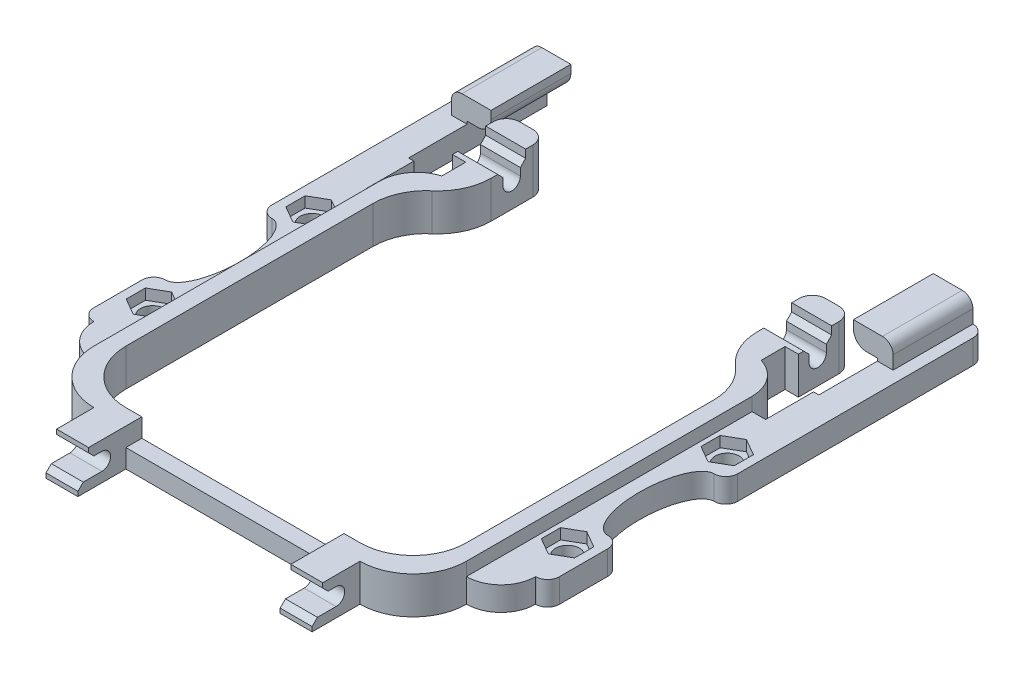
from build123d import *

# Parameters (mm, degrees)
BOSS_EXTRUDE1_DEPTH            = 7
CUT_EXTRUDE2_REACH             = 79.782
SKETCH2_W                      = 2
SKETCH2_H                      = 1.875
CUT_EXTRUDE5_DEPTH             = 65
CUT_EXTRUDE8_START             = -7
SKETCH9_W                      = 5
SKETCH9_H                      = 4.5
CUT_EXTRUDE8_DEPTH             = 7
FILLET1_R                      = 7
FILLET3_R                      = 10
FILLET5_R                      = 10
FILLET6_R                      = 10
FILLET7_R                      = 10
FILLET8_R                      = 2.5
CHAMFER2_SIZE                  = 1
CUT_EXTRUDE7_REACH             = 94.19
SKETCH20_W                     = 38
SKETCH20_H                     = 3.5
SKETCH22_W                     = 53.666796068
SKETCH22_H                     = 4.5
BOSS_EXTRUDE9_DEPTH            = 6.5
SKETCH24_W                     = 3.95
SKETCH24_H                     = 4.5
BOSS_EXTRUDE11_DEPTH           = 35
SKETCH25_W                     = 3.95
SKETCH25_H                     = 15
BOSS_EXTRUDE12_DEPTH           = 4.5
SKETCH28_W                     = 15
SKETCH28_H                     = 4
BOSS_EXTRUDE13_DEPTH           = 3.5
FILLET16_R                     = 2
FILLET17_R                     = 2.5
M4_CLEARANCE_HOLE1_D           = 4.5
M4_CLEARANCE_HOLE1_CSINK_D     = 4.55
M4_CLEARANCE_HOLE1_CSINK_ANGLE = 90
CUT_EXTRUDE9_REACH             = 77.297
SKETCH33_RX                    = 10
SKETCH33_RY                    = 4
SKETCH35_W                     = 1
SKETCH35_H                     = 5
CUT_EXTRUDE11_DEPTH            = 26
FILLET16_OF_MIRROR9_R          = 2
FILLET17_OF_MIRROR9_R          = 2.5
FILLET23_R                     = 6.5
SKETCH36_W                     = 48.666796068
SKETCH36_H                     = 4.5
SKETCH36_W_2                   = 13.5
BOSS_EXTRUDE14_DEPTH           = 2.25
FILLET24_R                     = 2.2
CUT_EXTRUDE12_DEPTH            = 2
FILLET24_OF_MIRROR10_R         = 2.2
BOSS_EXTRUDE15_START           = 1.5
BOSS_EXTRUDE15_DEPTH           = 1.5
CHAMFER4_SIZE                  = 1


# Some blends are built 0.0001 mm under size
with BuildPart() as part:
    # Sketch1 → Boss-Extrude1 (new body)
    with BuildSketch(Plane(origin=(0, 0, 0), x_dir=(1, 0, 0), z_dir=(0, 1, 0))):
        Polygon((-19, -45), (-19, -36), (19, -36), (19, -45), (25, -45), (25, -36), (35, -36), (35, 36), (32.5, 36), (32.5, 49), (25, 49), (25, 36), (25, 33), (32, 33), (32, -33), (-32, -33), (-32, 33), (-25, 33), (-25, 36), (-25, 49), (-32.5, 49), (-32.5, 36), (-35, 36), (-35, -36), (-25, -36), (-25, -45), align=None)
    extrude(amount=BOSS_EXTRUDE1_DEPTH)

    # Sketch2 → Cut-Extrude2 (cut, up to next)
    with BuildSketch(Plane(origin=(25, 0, 0), x_dir=(0, 0, -1), z_dir=(1, 0, 0)), mode=Mode.PRIVATE) as cut_extrude2_sk1:
        with Locations((-44, 6.0625)):
            Rectangle(SKETCH2_W, SKETCH2_H)
    cut_extrude2_tool1 = extrude(cut_extrude2_sk1.sketch, amount=-CUT_EXTRUDE2_REACH, mode=Mode.PRIVATE) & part.part
    # Sketch2 → Cut-Extrude2 (cut, up to next)
    with BuildSketch(Plane(origin=(25, 0, 0), x_dir=(0, 0, -1), z_dir=(1, 0, 0)), mode=Mode.PRIVATE) as cut_extrude2_sk2:
        with BuildLine():
            Line((-43, 5.125), (-45, 5.125))
            Line((-45, 5.125), (-45, 1.875))
            Line((-45, 1.875), (-40.5, 1.875))
            ThreePointArc((-40.5, 1.875), (-38.875, 3.5), (-40.5, 5.125))
            Line((-40.5, 5.125), (-43, 5.125))
        make_face()
    cut_extrude2_tool2 = extrude(cut_extrude2_sk2.sketch, amount=-CUT_EXTRUDE2_REACH, mode=Mode.PRIVATE) & part.part
    add(cut_extrude2_tool1.solids().sort_by_distance((25, 6.0625, 44))[0], mode=Mode.SUBTRACT)
    add(cut_extrude2_tool1.solids().sort_by_distance((25, 6.0625, 44))[1], mode=Mode.SUBTRACT)
    add(cut_extrude2_tool2.solids().sort_by_distance((25, 3.5, 42.100477))[0], mode=Mode.SUBTRACT)
    add(cut_extrude2_tool2.solids().sort_by_distance((25, 3.5, 42.100477))[1], mode=Mode.SUBTRACT)

    # Sketch3 → Cut-Extrude5 (cut)
    with BuildSketch(Plane(origin=(32.5, 0, 0), x_dir=(0, 0, -1), z_dir=(1, 0, 0))):
        with BuildLine():
            Line((44.125, 4.625), (44.125, 7))
            Line((44.125, 7), (40.875, 7))
            Line((40.875, 7), (40.875, 4.625))
            ThreePointArc((40.875, 4.625), (42.5, 3), (44.125, 4.625))
        make_face()
    extrude(amount=-CUT_EXTRUDE5_DEPTH, mode=Mode.SUBTRACT)

    # Sketch9 → Cut-Extrude8 (cut)
    with BuildSketch(Plane(origin=(0, 7, 0), x_dir=(1, 0, 0), z_dir=(0, 1, 0)).offset(CUT_EXTRUDE8_START)):
        with Locations((32.5, 36.625)):
            Rectangle(SKETCH9_W, SKETCH9_H)
    cut_extrude8 = extrude(amount=CUT_EXTRUDE8_DEPTH, mode=Mode.SUBTRACT)

    # Mirror1: Cut-Extrude8 across plane
    add(cut_extrude8.mirror(Plane.ZY), mode=Mode.SUBTRACT)

    # Fillet1
    # the kernel refuses this fillet: 7 mm, written as the material it takes off along each edge
    with BuildSketch(Plane(origin=(35, -16.770509831, -34.375), x_dir=(-1, 0, 0), z_dir=(0, 1, 0))) as fillet1_piece_1:
        with BuildLine():
            CenterArc((7, 6.708203932), FILLET1_R, 180, 73.398450401)
            Line((0, 6.708203932), (-0.14, 6.708203932))
            Line((-0.14, 6.708203932), (-0.14, 0))
            Line((-0.14, 0), (0, -0.14))
            ThreePointArc((0, -0.14), (2.5, -0.14), (4.96, -0.134164079))
            Line((4.96, -0.134164079), (5, 0))
        make_face()
    extrude(amount=40.541019662, mode=Mode.SUBTRACT)
    with BuildSketch(Plane(origin=(-35, -16.770509831, -34.375), x_dir=(0, 0, 1), z_dir=(0, 1, 0))) as fillet1_piece_2:
        with BuildLine():
            CenterArc((6.708203932, 7), FILLET1_R, 196.601549599, 73.398450401)
            Line((0, 5), (-0.134164079, 4.96))
            ThreePointArc((-0.134164079, 4.96), (-0.14, 2.5), (-0.14, 0))
            Line((-0.14, 0), (0, -0.14))
            Line((0, -0.14), (6.708203932, -0.14))
            Line((6.708203932, -0.14), (6.708203932, 0))
        make_face()
    extrude(amount=40.541019662, mode=Mode.SUBTRACT)

    # Fillet3
    # the kernel refuses this fillet: 10 mm, written as the material it adds along each edge
    with BuildSketch(Plane(origin=(32, 0, -33), x_dir=(0, 0, 1), z_dir=(0, 1, 0))) as fillet3_piece_1:
        with BuildLine():
            CenterArc((9.539392014, -10), FILLET3_R, 90, 72.542396876)
            Line((0, -7), (-0.19078784, -6.94))
            ThreePointArc((-0.19078784, -6.94), (-0.2, -3.5), (-0.2, 0))
            Line((-0.2, 0), (0, 0.2))
            Line((0, 0.2), (9.539392014, 0.2))
            Line((9.539392014, 0.2), (9.539392014, 0))
        make_face()
    extrude(amount=7)
    with BuildSketch(Plane(origin=(-32, 0, -33), x_dir=(1, 0, 0), z_dir=(0, 1, 0))) as fillet3_piece_2:
        with BuildLine():
            CenterArc((10, -9.539392014), FILLET3_R, 107.457603124, 72.542396876)
            Line((0, -9.539392014), (-0.2, -9.539392014))
            Line((-0.2, -9.539392014), (-0.2, 0))
            Line((-0.2, 0), (0, 0.2))
            ThreePointArc((0, 0.2), (3.5, 0.2), (6.94, 0.19078784))
            Line((6.94, 0.19078784), (7, 0))
        make_face()
    extrude(amount=7)

    # Fillet5
    fillet5_edges = [part.edges().sort_by_distance(p)[0] for p in [
        (35, 3.5, 36),
        (-35, 3.5, 36),
    ]]
    fillet(fillet5_edges, radius=FILLET5_R - 0.0001)  # a hair under: the kernel refuses the full size

    # Fillet6
    fillet6_edges = [part.edges().sort_by_distance(p)[0] for p in [
        (-32, 3.5, 33),
        (32, 3.5, 33),
    ]]
    fillet(fillet6_edges, radius=FILLET6_R)

    # Fillet7
    fillet7_edges = [part.edges().sort_by_distance(p)[0] for p in [
        (-25, 3.5, -33),
        (25, 3.5, -33),
    ]]
    fillet(fillet7_edges, radius=FILLET7_R)

    # Fillet8
    fillet8_edges = [part.edges().sort_by_distance(p)[0] for p in [
        (-32.5, 3.5, -49),
        (-25, 3.5, -49),
        (25, 3.5, -49),
        (32.5, 3.5, -49),
    ]]
    fillet(fillet8_edges, radius=FILLET8_R)

    # Chamfer2
    chamfer2_edges = [part.edges().sort_by_distance(p)[0] for p in [
        (28.75, 7, -40.875),
        (28.75, 7, -44.125),
        (-28.75, 7, -40.875),
        (-28.75, 7, -44.125),
    ]]
    chamfer(chamfer2_edges, length=CHAMFER2_SIZE)

    # Sketch20 → Cut-Extrude7 (cut, up to next)
    with BuildSketch(Plane.XY.offset(36), mode=Mode.PRIVATE) as cut_extrude7_sk1:
        with Locations((0, 5.25)):
            Rectangle(SKETCH20_W, SKETCH20_H)
    cut_extrude7_tool1 = extrude(cut_extrude7_sk1.sketch, amount=-CUT_EXTRUDE7_REACH, mode=Mode.PRIVATE) & part.part
    add(cut_extrude7_tool1.solids().sort_by_distance((0, 5.25, 36))[0], mode=Mode.SUBTRACT)

    # Sketch22 → Boss-Extrude9 (add)
    with BuildSketch(Plane.ZY.offset(35)):
        with Locations((-0.833398034, 2.25)):
            Rectangle(SKETCH22_W, SKETCH22_H)
    boss_extrude9 = extrude(amount=BOSS_EXTRUDE9_DEPTH)

    # Sketch24 → Boss-Extrude11 (add)
    with BuildSketch(Plane(origin=(0, 0, -27.666796068), x_dir=(-1, 0, 0), z_dir=(0, 0, -1))):
        with Locations((39.525, 2.25)):
            Rectangle(SKETCH24_W, SKETCH24_H)
    boss_extrude11 = extrude(amount=BOSS_EXTRUDE11_DEPTH)

    # Sketch25 → Boss-Extrude12 (add)
    with BuildSketch(Plane(origin=(0, 4.5, 0), x_dir=(1, 0, 0), z_dir=(0, 1, 0))):
        with Locations((-39.525, 55.166796068)):
            Rectangle(SKETCH25_W, SKETCH25_H)
    boss_extrude12 = extrude(amount=BOSS_EXTRUDE12_DEPTH)

    # Sketch28 → Boss-Extrude13 (add)
    with BuildSketch(Plane(origin=(-37.55, 0, 0), x_dir=(0, 0, -1), z_dir=(1, 0, 0))):
        with Locations((55.166796068, 7)):
            Rectangle(SKETCH28_W, SKETCH28_H)
    boss_extrude13 = extrude(amount=BOSS_EXTRUDE13_DEPTH)

    # Fillet16
    fillet16_edges = [part.edges().sort_by_distance(p)[0] for p in [
        (-41.5, 9, -55.166796068),
    ]]
    fillet(fillet16_edges, radius=FILLET16_R)

    # Fillet17
    fillet17_edges = [part.edges().sort_by_distance(p)[0] for p in [
        (-34.05, 5, -55.166796068),
    ]]
    fillet(fillet17_edges, radius=FILLET17_R)

    # M4 Clearance Hole1 (through all)
    with Locations(Plane(origin=(0, 4.5, 0), x_dir=(1, 0, 0), z_dir=(0, 1, 0))):
        with Locations((-39, -11), (-39, 19)):
            m4_clearance_hole1 = CounterSinkHole(M4_CLEARANCE_HOLE1_D / 2, M4_CLEARANCE_HOLE1_CSINK_D / 2, counter_sink_angle=M4_CLEARANCE_HOLE1_CSINK_ANGLE)

    # Sketch33 → Cut-Extrude9 (cut, up to next)
    with BuildSketch(Plane(origin=(0, 4.5, 0), x_dir=(1, 0, 0), z_dir=(0, 1, 0)), mode=Mode.PRIVATE) as cut_extrude9_sk1:
        with Locations(Location((-41.5, 4), (0, 0, 90))):
            Ellipse(SKETCH33_RX, SKETCH33_RY)
    cut_extrude9_tool1 = extrude(cut_extrude9_sk1.sketch, amount=-CUT_EXTRUDE9_REACH, mode=Mode.PRIVATE) & part.part
    cut_extrude9 = cut_extrude9_tool1.solids().sort_by_distance((-41.5, 4.5, -4))[0]
    add(cut_extrude9, mode=Mode.SUBTRACT)

    # Sketch35 → Cut-Extrude11 (cut)
    with BuildSketch(Plane(origin=(0, 0, -62.666796068), x_dir=(-1, 0, 0), z_dir=(0, 0, -1))):
        with Locations((38.05, 2.5)):
            Rectangle(SKETCH35_W, SKETCH35_H)
    cut_extrude11 = extrude(amount=-CUT_EXTRUDE11_DEPTH, mode=Mode.SUBTRACT)

    # Mirror9: Boss-Extrude9, Boss-Extrude11, Boss-Extrude12, Boss-Extrude13, M4 Clearance Hole1, Cut-Extrude9, Cut-Extrude11 across plane
    add(boss_extrude9.mirror(Plane.ZY))
    add(boss_extrude11.mirror(Plane.ZY))
    add(boss_extrude12.mirror(Plane.ZY))
    add(boss_extrude13.mirror(Plane.ZY))
    add(m4_clearance_hole1.mirror(Plane.ZY), mode=Mode.SUBTRACT)
    add(cut_extrude9.mirror(Plane.ZY), mode=Mode.SUBTRACT)
    add(cut_extrude11.mirror(Plane.ZY), mode=Mode.SUBTRACT)

    # Fillet16 of Mirror9
    fillet16_of_mirror9_edges = [part.edges().sort_by_distance(p)[0] for p in [
        (41.5, 9, -55.166796068),
    ]]
    fillet(fillet16_of_mirror9_edges, radius=FILLET16_OF_MIRROR9_R)

    # Fillet17 of Mirror9
    fillet17_of_mirror9_edges = [part.edges().sort_by_distance(p)[0] for p in [
        (34.05, 5, -55.166796068),
    ]]
    fillet(fillet17_of_mirror9_edges, radius=FILLET17_OF_MIRROR9_R)

    # Fillet23
    fillet23_edges = [part.edges().sort_by_distance(p)[0] for p in [
        (-41.5, 2.25, 26),
        (41.5, 2.25, 26),
    ]]
    fillet(fillet23_edges, radius=FILLET23_R - 0.0001)  # a hair under: the kernel refuses the full size

    # Sketch36 → Boss-Extrude14 (add)
    with BuildSketch(Plane.ZY.offset(41.5)):
        with Locations((-38.333398034, 2.25)):
            Rectangle(SKETCH36_W, SKETCH36_H)
        with Locations((12.75, 2.25)):
            Rectangle(SKETCH36_W_2, SKETCH36_H)
    boss_extrude14 = extrude(amount=BOSS_EXTRUDE14_DEPTH)

    # Fillet24
    fillet24_edges = [part.edges().sort_by_distance(p)[0] for p in [
        (-43.75, 2.25, -14),
        (-43.75, 2.25, -62.666796068),
        (-43.75, 2.25, 6),
        (-43.75, 2.25, 19.5),
    ]]
    fillet(fillet24_edges, radius=FILLET24_R)

    # Sketch37 → Cut-Extrude12 (cut)
    with BuildSketch(Plane(origin=(0, 4.5, 0), x_dir=(1, 0, 0), z_dir=(0, 1, 0))):
        Polygon((-39, 22.608439182), (-42.125, 20.804219591), (-42.125, 17.195780409), (-39, 15.391560818), (-35.875, 17.195780409), (-35.875, 20.804219591), align=None)
        Polygon((-39, -7.391560818), (-42.125, -9.195780409), (-42.125, -12.804219591), (-39, -14.608439182), (-35.875, -12.804219591), (-35.875, -9.195780409), align=None)
    cut_extrude12 = extrude(amount=-CUT_EXTRUDE12_DEPTH, mode=Mode.SUBTRACT)

    # Mirror10: Boss-Extrude14, Cut-Extrude12 across plane
    add(boss_extrude14.mirror(Plane.ZY))
    add(cut_extrude12.mirror(Plane.ZY), mode=Mode.SUBTRACT)

    # Fillet24 of Mirror10
    fillet24_of_mirror10_edges = [part.edges().sort_by_distance(p)[0] for p in [
        (43.75, 2.25, -14),
        (43.75, 2.25, -62.666796068),
        (43.75, 2.25, 6),
        (43.75, 2.25, 19.5),
    ]]
    fillet(fillet24_of_mirror10_edges, radius=FILLET24_OF_MIRROR10_R)

    # Sketch38 → Boss-Extrude15 (add)
    with BuildSketch(Plane(origin=(0, 7, 0), x_dir=(1, 0, 0), z_dir=(0, 1, 0)).offset(BOSS_EXTRUDE15_START)):
        with BuildLine():
            Line((-32.5, 45.125), (-25, 45.125))
            Line((-25, 45.125), (-25, 46.5))
            ThreePointArc((-25, 46.5), (-25.732233047, 48.267766953), (-27.5, 49))
            Line((-27.5, 49), (-30, 49))
            ThreePointArc((-30, 49), (-31.767766953, 48.267766953), (-32.5, 46.5))
            Line((-32.5, 46.5), (-32.5, 45.125))
        make_face()
        with BuildLine():
            Line((25, 45.125), (32.5, 45.125))
            Line((32.5, 45.125), (32.5, 46.5))
            ThreePointArc((32.5, 46.5), (31.767766953, 48.267766953), (30, 49))
            Line((30, 49), (27.5, 49))
            ThreePointArc((27.5, 49), (25.732233047, 48.267766953), (25, 46.5))
            Line((25, 46.5), (25, 45.125))
        make_face()
    extrude(amount=-BOSS_EXTRUDE15_DEPTH)

    # Chamfer4
    chamfer4_edges = [part.edges().sort_by_distance(p)[0] for p in [
        (-22, 5.125, 43),
        (22, 5.125, 43),
        (-22, 1.875, 45),
        (22, 1.875, 45),
    ]]
    chamfer(chamfer4_edges, length=CHAMFER4_SIZE)


solid = part.part
